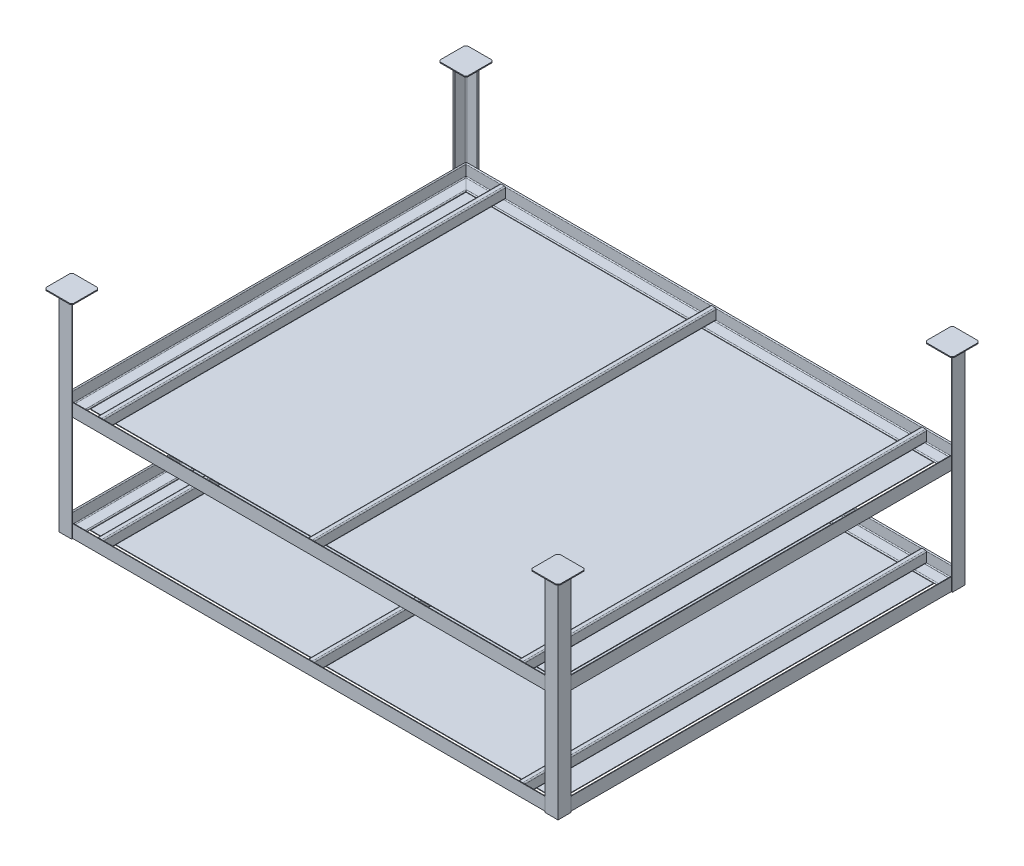
from build123d import *

# Parameters (mm, degrees)
F_35_X_35_X_5_1_DEPTH      = 2800.137813948
F_35_X_35_X_5_1_DEPTH_BACK = 100.137813948
F_35_X_35_X_5_1_2_DEPTH    = 2400.275627895
F_35_X_35_X_5_1_3_DEPTH    = 2900.275627895
F_35_X_35_X_5_1_4_DEPTH    = 2400.275627895
MOVE_BODY_1_ANGLE          = 180
F_35_X_35_X_5_2_DEPTH      = 1139.963998704
SKETCH_3_W                 = 150
SKETCH_3_H                 = 150
EXTRUDE_1_DEPTH            = 5
CHAMFER_1_SIZE             = 10
F_60_X_40_X_3_2_1_DEPTH    = 2188
F_60_X_40_X_3_2_1_2_DEPTH  = 2188
F_60_X_40_X_3_2_1_3_DEPTH  = 2188
SKETCH_5_W                 = 2540
SKETCH_5_H                 = 2040
EXTRUDE_2_DEPTH            = 3


with BuildPart() as part:
    # Sketch11 → Угольник 35 X 35 X 5(1) (new, two sides: drawn at the far end of the back side and taken through both)
    with BuildSketch(Plane(origin=(-1350, 0, -1100), x_dir=(0, 1, 0), z_dir=(1, 0, 0)).offset(-F_35_X_35_X_5_1_DEPTH_BACK)):
        with BuildLine():
            Line((0, 0), (0, 70))
            ThreePointArc((0, 70), (4.16227766, 68.974003861), (6, 65.101020514))
            Line((6, 65.101020514), (6, 11))
            ThreePointArc((6, 11), (7.464466094, 7.464466094), (11, 6))
            Line((11, 6), (65.101020514, 6))
            ThreePointArc((65.101020514, 6), (68.974003861, 4.16227766), (70, 0))
            Line((70, 0), (0, 0))
        make_face()
    extrude(amount=F_35_X_35_X_5_1_DEPTH + F_35_X_35_X_5_1_DEPTH_BACK)

    # Угольник 35 X 35 X 5(1) mitre 1
    split(bisect_by=Plane(origin=(-1350, 0, -1100), x_dir=(0, 1, 0), z_dir=(0.707106781, 0, -0.707106781)), keep=Keep.TOP)

    # Угольник 35 X 35 X 5(1) mitre 2
    split(bisect_by=Plane(origin=(1350, 0, -1100), x_dir=(0, -1, 0), z_dir=(-0.707106781, 0, -0.707106781)), keep=Keep.TOP)


with BuildPart() as body_2:
    # Sketch11 on segment 2 (carried to segment 2) → 35 X 35 X 5_1 2 (new body)
    with BuildSketch(Plane(origin=(1350, 0, -1200.137813948), x_dir=(0, 1, 0), z_dir=(0, 0, 1))):
        with BuildLine():
            Line((0, 0), (0, 70))
            ThreePointArc((0, 70), (4.16227766, 68.974003861), (6, 65.101020514))
            Line((6, 65.101020514), (6, 11))
            ThreePointArc((6, 11), (7.464466094, 7.464466094), (11, 6))
            Line((11, 6), (65.101020514, 6))
            ThreePointArc((65.101020514, 6), (68.974003861, 4.16227766), (70, 0))
            Line((70, 0), (0, 0))
        make_face()
    extrude(amount=F_35_X_35_X_5_1_2_DEPTH)

    # 35 X 35 X 5_1 2 mitre 1
    split(bisect_by=Plane(origin=(1350, 0, 1100), x_dir=(0, 1, 0), z_dir=(0.707106781, 0, -0.707106781)), keep=Keep.TOP)

    # 35 X 35 X 5_1 2 mitre 2
    split(bisect_by=Plane(origin=(1350, 0, -1100), x_dir=(0, 1, 0), z_dir=(0.707106781, 0, 0.707106781)), keep=Keep.TOP)


with BuildPart() as body_3:
    # Sketch11 on segment 3 (carried to segment 3) → 35 X 35 X 5_1 3 (new body)
    with BuildSketch(Plane(origin=(1450.137813948, 0, 1100), x_dir=(0, 1, 0), z_dir=(-1, 0, 0))):
        with BuildLine():
            Line((0, 0), (0, 70))
            ThreePointArc((0, 70), (4.16227766, 68.974003861), (6, 65.101020514))
            Line((6, 65.101020514), (6, 11))
            ThreePointArc((6, 11), (7.464466094, 7.464466094), (11, 6))
            Line((11, 6), (65.101020514, 6))
            ThreePointArc((65.101020514, 6), (68.974003861, 4.16227766), (70, 0))
            Line((70, 0), (0, 0))
        make_face()
    extrude(amount=F_35_X_35_X_5_1_3_DEPTH)

    # 35 X 35 X 5_1 3 mitre 1
    split(bisect_by=Plane(origin=(-1350, 0, 1100), x_dir=(0, 1, 0), z_dir=(0.707106781, 0, 0.707106781)), keep=Keep.TOP)

    # 35 X 35 X 5_1 3 mitre 2
    split(bisect_by=Plane(origin=(1350, 0, 1100), x_dir=(0, -1, 0), z_dir=(-0.707106781, 0, 0.707106781)), keep=Keep.TOP)


with BuildPart() as body_4:
    # Sketch11 on segment 4 (carried to segment 4) → 35 X 35 X 5_1 4 (new body)
    with BuildSketch(Plane(origin=(-1350, 0, 1200.137813948), x_dir=(0, 1, 0), z_dir=(0, 0, -1))):
        with BuildLine():
            Line((0, 0), (0, 70))
            ThreePointArc((0, 70), (4.16227766, 68.974003861), (6, 65.101020514))
            Line((6, 65.101020514), (6, 11))
            ThreePointArc((6, 11), (7.464466094, 7.464466094), (11, 6))
            Line((11, 6), (65.101020514, 6))
            ThreePointArc((65.101020514, 6), (68.974003861, 4.16227766), (70, 0))
            Line((70, 0), (0, 0))
        make_face()
    extrude(amount=F_35_X_35_X_5_1_4_DEPTH)

    # 35 X 35 X 5_1 4 mitre 1
    split(bisect_by=Plane(origin=(-1350, 0, 1100), x_dir=(0, -1, 0), z_dir=(-0.707106781, 0, -0.707106781)), keep=Keep.TOP)

    # 35 X 35 X 5_1 4 mitre 2
    split(bisect_by=Plane(origin=(-1350, 0, -1100), x_dir=(0, -1, 0), z_dir=(-0.707106781, 0, 0.707106781)), keep=Keep.TOP)


with BuildPart() as body_5:
    # Move Body 1: read off the stored shape, not the designer's step
    # Move Body 1: copy of part
    add(part.part.moved(Location((0, 570, 0))).rotate(Axis((0, 0, 0), (0, 1, 0)), MOVE_BODY_1_ANGLE))


with BuildPart() as body_6:
    # Move Body 1 2: copy of body 2
    add(body_2.part.moved(Location((0, 570, 0))))


with BuildPart() as body_7:
    # Move Body 1 3: copy of part
    add(part.part.moved(Location((0, 570, 0))))


with BuildPart() as body_8:
    # Move Body 1 4: copy of body 4
    add(body_4.part.moved(Location((0, 570, 0))))


with BuildPart() as body_9:
    # Sketch1 → Угольник 35 X 35 X 5(2) (new body)
    with BuildSketch(Plane(origin=(-1356, 0, 1106), x_dir=(1, 0, 0), z_dir=(0, 1, 0))):
        with BuildLine():
            Line((0, 0), (0, 70))
            ThreePointArc((0, 70), (4.16227766, 68.974003861), (6, 65.101020514))
            Line((6, 65.101020514), (6, 11))
            ThreePointArc((6, 11), (7.464466094, 7.464466094), (11, 6))
            Line((11, 6), (65.101020514, 6))
            ThreePointArc((65.101020514, 6), (68.974003861, 4.16227766), (70, 0))
            Line((70, 0), (0, 0))
        make_face()
    extrude(amount=F_35_X_35_X_5_2_DEPTH)


with BuildPart() as body_10:
    # Зеркальное отражение1: mirrored copy
    add(body_9.part.mirror(Plane(origin=(0, 0, 0), x_dir=(0, 0, 1), z_dir=(1, 0, 0))))


with BuildPart() as body_11:
    # Зеркальное отражение2: mirrored copy
    add(body_9.part.mirror(Plane.XY))


with BuildPart() as body_12:
    # Mirror 2 2: mirrored copy
    add(body_10.part.mirror(Plane.XY))


with BuildPart() as body_13:
    # Эскиз3 → Бобышка-Вытянуть1 (new body)
    with BuildSketch(Plane(origin=(0, 1139.963998704, 0), x_dir=(1, 0, 0), z_dir=(0, 1, 0))):
        with Locations((-1321, -1071)):
            Rectangle(SKETCH_3_W, SKETCH_3_H)
    extrude(amount=EXTRUDE_1_DEPTH)

    # Фаска1
    chamfer_1_edges = [body_13.edges().sort_by_distance(p)[0] for p in [
        (-1246, 1142.463998704, 1146),
        (-1396, 1142.463998704, 1146),
        (-1396, 1142.463998704, 996),
        (-1246, 1142.463998704, 996),
    ]]
    chamfer(chamfer_1_edges, length=CHAMFER_1_SIZE)


with BuildPart() as body_14:
    # Зеркальное отражение3: mirrored copy
    add(body_13.part.mirror(Plane(origin=(0, 0, 0), x_dir=(0, 0, 1), z_dir=(1, 0, 0))))


with BuildPart() as body_15:
    # Зеркальное отражение4: mirrored copy
    add(body_13.part.mirror(Plane.XY))


with BuildPart() as body_16:
    # Mirror 4 2: mirrored copy
    add(body_14.part.mirror(Plane.XY))


with BuildPart() as body_17:
    # Sketch12 → Прямоугольная труба 60 X 40 X 3.2(1) (new body)
    with BuildSketch(Plane(origin=(-1144, 608.050510257, 1094), x_dir=(1, 0, 0), z_dir=(0, 0, -1))):
        with BuildLine():
            Line((-8.6, -30), (8.6, -30))
            ThreePointArc((8.6, -30), (13.1254834, -28.1254834), (15, -23.6))
            Line((15, -23.6), (15, 23.6))
            ThreePointArc((15, 23.6), (13.1254834, 28.1254834), (8.6, 30))
            Line((8.6, 30), (-8.6, 30))
            ThreePointArc((-8.6, 30), (-13.1254834, 28.1254834), (-15, 23.6))
            Line((-15, 23.6), (-15, -23.6))
            ThreePointArc((-15, -23.6), (-13.1254834, -28.1254834), (-8.6, -30))
        make_face()
        with BuildLine():
            Line((-8.6, -26.8), (8.6, -26.8))
            ThreePointArc((8.6, -26.8), (10.8627417, -25.8627417), (11.8, -23.6))
            Line((11.8, -23.6), (11.8, 23.6))
            ThreePointArc((11.8, 23.6), (10.8627417, 25.8627417), (8.6, 26.8))
            Line((8.6, 26.8), (-8.6, 26.8))
            ThreePointArc((-8.6, 26.8), (-10.8627417, 25.8627417), (-11.8, 23.6))
            Line((-11.8, 23.6), (-11.8, -23.6))
            ThreePointArc((-11.8, -23.6), (-10.8627417, -25.8627417), (-8.6, -26.8))
        make_face(mode=Mode.SUBTRACT)
    extrude(amount=F_60_X_40_X_3_2_1_DEPTH)


with BuildPart() as body_18:
    # Sketch12 on segment 2 (carried to segment 2) → 60 X 40 X 3.2_1 2 (new body)
    with BuildSketch(Plane(origin=(1144, 608.050510257, 1094), x_dir=(1, 0, 0), z_dir=(0, 0, -1))):
        with BuildLine():
            Line((-8.6, -30), (8.6, -30))
            ThreePointArc((8.6, -30), (13.1254834, -28.1254834), (15, -23.6))
            Line((15, -23.6), (15, 23.6))
            ThreePointArc((15, 23.6), (13.1254834, 28.1254834), (8.6, 30))
            Line((8.6, 30), (-8.6, 30))
            ThreePointArc((-8.6, 30), (-13.1254834, 28.1254834), (-15, 23.6))
            Line((-15, 23.6), (-15, -23.6))
            ThreePointArc((-15, -23.6), (-13.1254834, -28.1254834), (-8.6, -30))
        make_face()
        with BuildLine():
            Line((-8.6, -26.8), (8.6, -26.8))
            ThreePointArc((8.6, -26.8), (10.8627417, -25.8627417), (11.8, -23.6))
            Line((11.8, -23.6), (11.8, 23.6))
            ThreePointArc((11.8, 23.6), (10.8627417, 25.8627417), (8.6, 26.8))
            Line((8.6, 26.8), (-8.6, 26.8))
            ThreePointArc((-8.6, 26.8), (-10.8627417, 25.8627417), (-11.8, 23.6))
            Line((-11.8, 23.6), (-11.8, -23.6))
            ThreePointArc((-11.8, -23.6), (-10.8627417, -25.8627417), (-8.6, -26.8))
        make_face(mode=Mode.SUBTRACT)
    extrude(amount=F_60_X_40_X_3_2_1_2_DEPTH)


with BuildPart() as body_19:
    # Sketch12 on segment 3 (carried to segment 3) → 60 X 40 X 3.2_1 3 (new body)
    with BuildSketch(Plane(origin=(0, 608.050510257, 1094), x_dir=(1, 0, 0), z_dir=(0, 0, -1))):
        with BuildLine():
            Line((-8.6, -30), (8.6, -30))
            ThreePointArc((8.6, -30), (13.1254834, -28.1254834), (15, -23.6))
            Line((15, -23.6), (15, 23.6))
            ThreePointArc((15, 23.6), (13.1254834, 28.1254834), (8.6, 30))
            Line((8.6, 30), (-8.6, 30))
            ThreePointArc((-8.6, 30), (-13.1254834, 28.1254834), (-15, 23.6))
            Line((-15, 23.6), (-15, -23.6))
            ThreePointArc((-15, -23.6), (-13.1254834, -28.1254834), (-8.6, -30))
        make_face()
        with BuildLine():
            Line((-8.6, -26.8), (8.6, -26.8))
            ThreePointArc((8.6, -26.8), (10.8627417, -25.8627417), (11.8, -23.6))
            Line((11.8, -23.6), (11.8, 23.6))
            ThreePointArc((11.8, 23.6), (10.8627417, 25.8627417), (8.6, 26.8))
            Line((8.6, 26.8), (-8.6, 26.8))
            ThreePointArc((-8.6, 26.8), (-10.8627417, 25.8627417), (-11.8, 23.6))
            Line((-11.8, 23.6), (-11.8, -23.6))
            ThreePointArc((-11.8, -23.6), (-10.8627417, -25.8627417), (-8.6, -26.8))
        make_face(mode=Mode.SUBTRACT)
    extrude(amount=F_60_X_40_X_3_2_1_3_DEPTH)


with BuildPart() as body_20:
    # Эскиз5 → Бобышка-Вытянуть2 (new body)
    with BuildSketch(Plane.XZ.offset(-578.050510257)):
        Rectangle(SKETCH_5_W, SKETCH_5_H)
    extrude(amount=EXTRUDE_2_DEPTH)


with BuildPart() as body_21:
    # Move Body 2: read off the stored shape, not the designer's step
    # Move Body 2: copy of body 20
    add(body_20.part.moved(Location((0, -570, 0))))


with BuildPart() as body_22:
    # Move Body 2 2: copy of body 19
    add(body_19.part.moved(Location((0, -570, 0))))


with BuildPart() as body_23:
    # Move Body 2 3: copy of body 19
    add(body_19.part.moved(Location((1144, -570, 0))))


with BuildPart() as body_24:
    # Move Body 2 4: copy of body 19
    add(body_19.part.moved(Location((-1144, -570, 0))))


solid = Compound([part.part, body_2.part, body_3.part, body_4.part, body_5.part, body_6.part, body_7.part, body_8.part, body_9.part, body_10.part, body_11.part, body_12.part, body_13.part, body_14.part, body_15.part, body_16.part, body_17.part, body_18.part, body_19.part, body_20.part, body_21.part, body_22.part, body_23.part, body_24.part])
